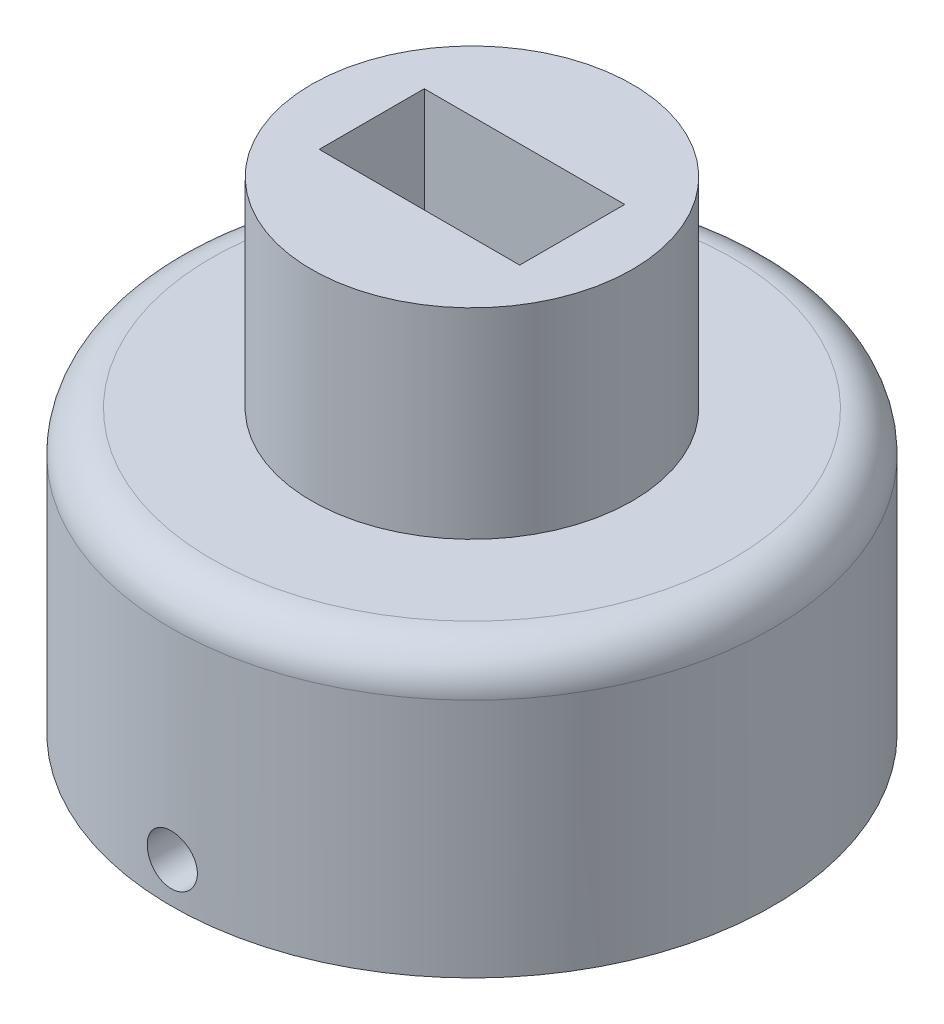
from build123d import *

# Parameters (mm, degrees)
CUT_EXTRUDE1_DEPTH      = 2.54
SKETCH4_W               = 6.35
SKETCH4_H               = 3.3274
CUT_EXTRUDE2_DEPTH      = 7.112
CUT_EXTRUDE3_DEPTH      = 24.979133637
CUT_EXTRUDE3_DEPTH_BACK = 24.979133637
SKETCH5_R               = 0.79375
FILLET2_R               = 1.27


with BuildPart() as part:
    # Sketch2 → Revolve1 (revolve)
    with BuildSketch(Plane.XY):
        Polygon((9.525, 0), (9.525, 8.89), (5.08, 8.89), (5.08, 15.24), (0, 15.24), (0, 0), align=None)
    revolve(axis=Axis((0, 15.24, 0), (0, -1, 0)))

    # Sketch3 → Cut-Extrude1 (cut)
    with BuildSketch(Plane.XZ):
        Polygon((7.332348419, 0), (3.666174209, 6.35), (-3.666174209, 6.35), (-7.332348419, 0), (-3.666174209, -6.35), (3.666174209, -6.35), align=None)
    extrude(amount=-CUT_EXTRUDE1_DEPTH, mode=Mode.SUBTRACT)

    # Sketch4 → Cut-Extrude2 (cut)
    with BuildSketch(Plane(origin=(0, 15.24, 0), x_dir=(1, 0, 0), z_dir=(0, 1, 0))):
        Rectangle(SKETCH4_W, SKETCH4_H)
    extrude(amount=-CUT_EXTRUDE2_DEPTH, mode=Mode.SUBTRACT)

    # Sketch5 → Cut-Extrude3 (cut, two sides: drawn at the far end of the back side and taken through both)
    with BuildSketch(Plane.XY.offset(-6.35).offset(-CUT_EXTRUDE3_DEPTH_BACK)):
        with Locations((0, 1.27)):
            Circle(SKETCH5_R)
    extrude(amount=CUT_EXTRUDE3_DEPTH + CUT_EXTRUDE3_DEPTH_BACK, mode=Mode.SUBTRACT)

    # Fillet2
    fillet2_edges = [part.edges().sort_by_distance(p)[0] for p in [
        (-9.525, 8.89, 0),
    ]]
    fillet(fillet2_edges, radius=FILLET2_R)


solid = part.part
